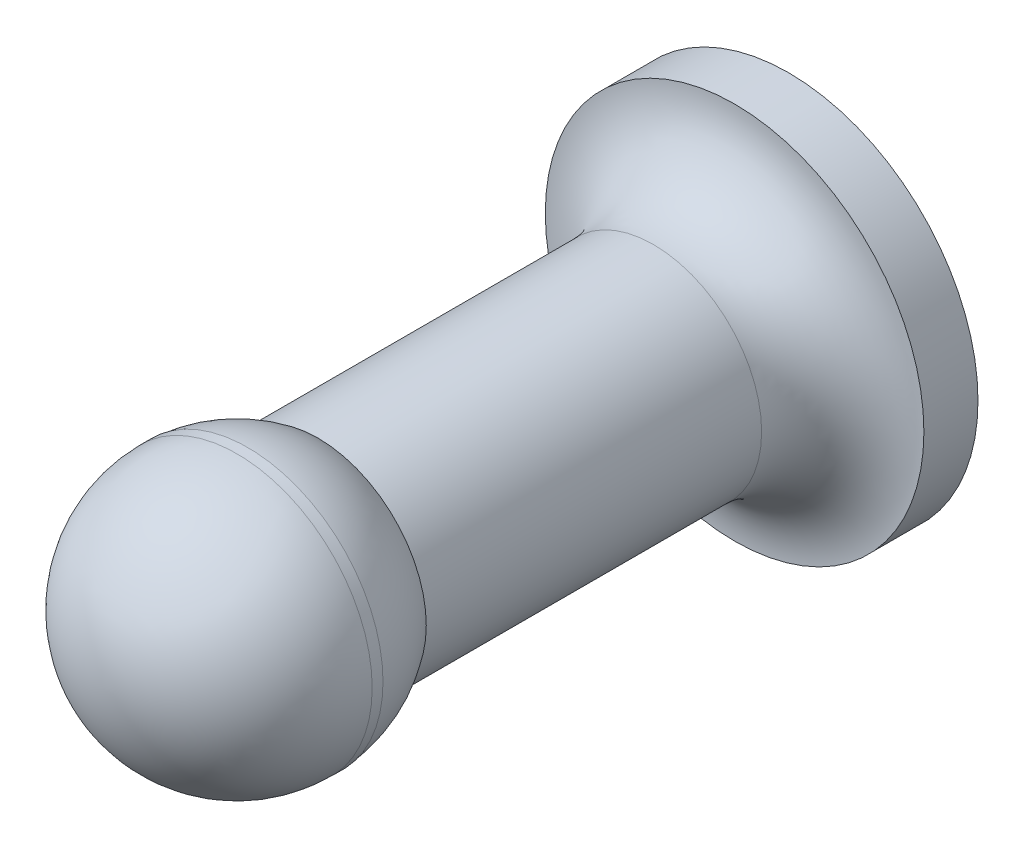
from build123d import *

# Parameters (mm, degrees)
SKETCH1_R           = 17.5
BOSS_EXTRUDE1_DEPTH = 5
SKETCH3_R           = 10
BOSS_EXTRUDE2_DEPTH = 50
SKETCH6_R           = 12.5
BOSS_EXTRUDE3_DEPTH = 1
FILLET1_R           = 7.5


with BuildPart() as part:
    # Sketch1 → Boss-Extrude1 (new body)
    with BuildSketch(Plane.XY):
        Circle(SKETCH1_R)
    extrude(amount=BOSS_EXTRUDE1_DEPTH)

    # Sketch3 → Boss-Extrude2 (add)
    with BuildSketch(Plane.XY):
        Circle(SKETCH3_R)
    extrude(amount=BOSS_EXTRUDE2_DEPTH)

    # Sketch6 → Boss-Extrude3 (add)
    with BuildSketch(Plane.XY.offset(50)):
        Circle(SKETCH6_R)
    extrude(amount=BOSS_EXTRUDE3_DEPTH)

    # Sketch7 → Revolve5 (revolve)
    with BuildSketch(Plane.XY.offset(51)):
        with BuildLine():
            Line((0, 12.5), (0, -12.5))
            ThreePointArc((0, -12.5), (-12.5, 0), (0, 12.5))
        make_face()
    revolve(axis=Axis((0, 12.5, 51), (0, -1, 0)))

    # Fillet1
    fillet1_edges = [part.edges().sort_by_distance(p)[0] for p in [
        (-10, 0, 5),
    ]]
    fillet(fillet1_edges, radius=FILLET1_R - 0.0001)  # a hair under: the kernel refuses the full size


solid = part.part
